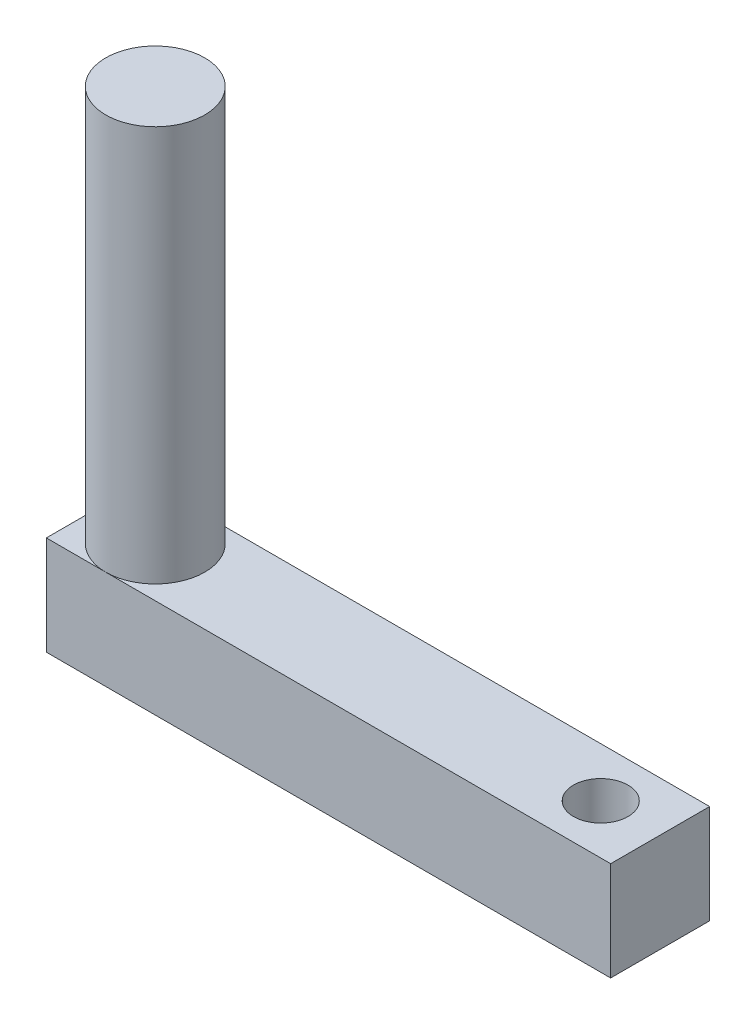
from build123d import *

# Parameters (mm, degrees)
SKETCH1_W           = 36.195
SKETCH1_H           = 6.35
SKETCH1_R           = 1.75
BOSS_EXTRUDE1_DEPTH = 6.35
BOSS_EXTRUDE2_START = -6.35
SKETCH2_R           = 3.175
BOSS_EXTRUDE2_DEPTH = 25.4


with BuildPart() as part:
    # Sketch1 → Boss-Extrude1 (new body)
    with BuildSketch(Plane(origin=(0, 0, 0), x_dir=(1, 0, 0), z_dir=(0, 1, 0))):
        with Locations((18.0975, 3.175)):
            Rectangle(SKETCH1_W, SKETCH1_H)
        with Locations((32.385, 3.175)):
            Circle(SKETCH1_R, mode=Mode.SUBTRACT)
    extrude(amount=-BOSS_EXTRUDE1_DEPTH)

    # Sketch2 → Boss-Extrude2 (add)
    with BuildSketch(Plane.XZ.offset(6.35).offset(BOSS_EXTRUDE2_START)):
        with Locations((3.81, -3.175)):
            Circle(SKETCH2_R)
    extrude(amount=-BOSS_EXTRUDE2_DEPTH)


solid = part.part
